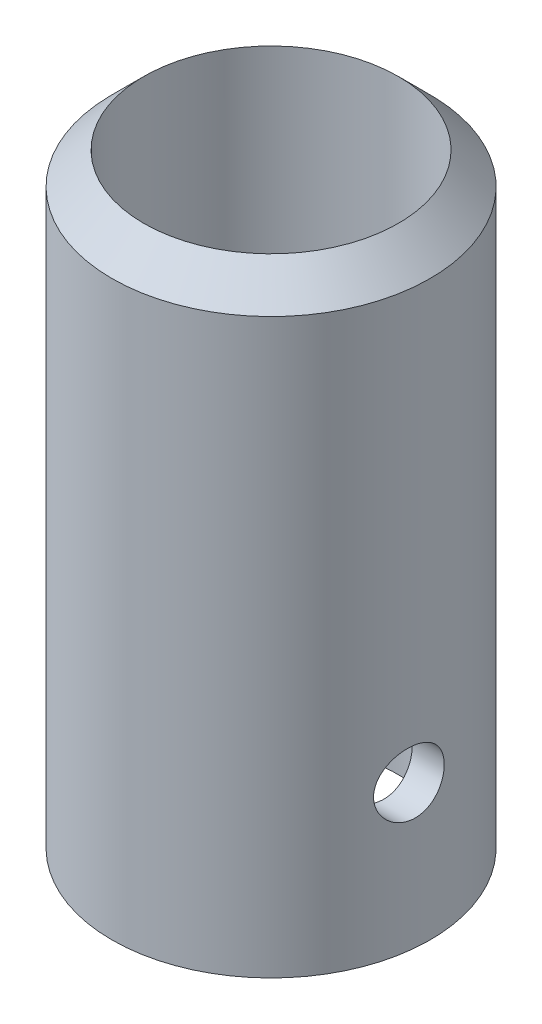
from build123d import *

# Parameters (mm, degrees)
SKETCH2_R           = 25
BOSS_EXTRUDE2_DEPTH = 100
SKETCH3_R           = 20
CUT_EXTRUDE1_DEPTH  = 158.111733872
CHAMFER2_SIZE       = 10
SKETCH4_R           = 5
CUT_EXTRUDE3_DEPTH  = 154.977585945


with BuildPart() as part:
    # Sketch2 → Boss-Extrude2 (new body)
    with BuildSketch(Plane(origin=(0, 0, 0), x_dir=(1, 0, 0), z_dir=(0, 1, 0))):
        with Locations(Location((72.581654817, 46.846486091, 0), (0, 0, 270))):
            Circle(SKETCH2_R)
    extrude(amount=BOSS_EXTRUDE2_DEPTH)

    # Sketch3 → Cut-Extrude1 (cut, through all)
    with BuildSketch(Plane(origin=(0, 100, 0), x_dir=(1, 0, 0), z_dir=(0, 1, 0))):
        with Locations(Location((72.581654817, 46.846486091, 0), (0, 0, 270))):
            Circle(SKETCH3_R)
    extrude(amount=-CUT_EXTRUDE1_DEPTH, mode=Mode.SUBTRACT)

    # Chamfer2
    # the kernel refuses this chamfer: 10 mm, written as the material it takes off along each edge
    with BuildSketch(Plane(origin=(72.581654817, 100, -46.846486091), x_dir=(0, 0, 1), z_dir=(-1, 0, 0))) as chamfer2_piece_1:
        Polygon((25, -CHAMFER2_SIZE), (25 - CHAMFER2_SIZE, 0), (25, 0), align=None)
    revolve(axis=Axis((72.581654817, 100, -46.846486091), (0, 1, 0)), mode=Mode.SUBTRACT)

    # Sketch4 → Cut-Extrude3 (cut, through all)
    with BuildSketch(Plane(origin=(0, 0, 0), x_dir=(0, 0, -1), z_dir=(1, 0, 0))):
        with Locations(Location((44.161502289, 22.651407336, 0), (0, 0, 180))):
            Circle(SKETCH4_R)
    extrude(amount=CUT_EXTRUDE3_DEPTH, mode=Mode.SUBTRACT)


solid = part.part
